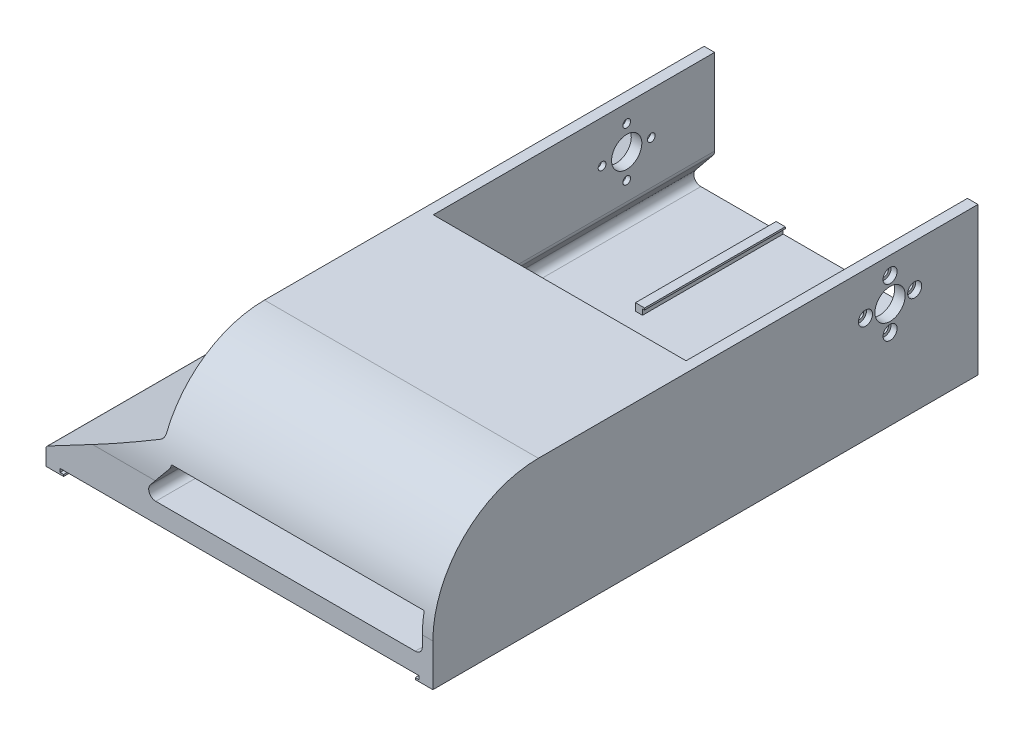
from build123d import *

# Parameters (mm, degrees)
BOSS_EXTRUDE1_DEPTH = 155
SKETCH3_R           = 4.3
SKETCH3_R_2         = 1.2
CUT_EXTRUDE1_DEPTH  = 3
SKETCH2_R           = 4.3
SKETCH2_R_2         = 1.1
CUT_EXTRUDE2_DEPTH  = 178.191866295
SKETCH4_R           = 2
CUT_EXTRUDE3_DEPTH  = 1.7
CUT_EXTRUDE4_START  = -1.7
SKETCH5_R           = 2
CUT_EXTRUDE4_DEPTH  = 1.7
CUT_EXTRUDE5_START  = -1.7
SKETCH5_4_R         = 2
CUT_EXTRUDE5_DEPTH  = 181.180461853
FILLET1_R           = 2
FILLET2_R           = 1
BOSS_EXTRUDE3_DEPTH = 71.886297018
FILLET3_R           = 30
BOSS_EXTRUDE4_DEPTH = 40


with BuildPart() as part:
    # Sketch1 → Boss-Extrude1 (new body)
    with BuildSketch(Plane.XY):
        Polygon((29.816959294, 42), (29.816959294, 17), (21.703256312, 7), (101.703256312, 7), (101.703256312, 42), (104.703256312, 42), (104.703256312, 14.387755102), (104.703256312, 0), (99.703256312, 0), (99.703256312, 0.5), (100.703256312, 0.5), (100.703256312, 1.5), (-1.296743688, 1.5), (-1.296743688, 0.5), (-0.296743688, 0.5), (-0.296743688, 0), (-5.296743688, 0), (-5.296743688, 5), (26.816959294, 22), (26.816959294, 42), align=None)
    extrude(amount=BOSS_EXTRUDE1_DEPTH)

    # Sketch3 → Cut-Extrude1 (cut)
    with BuildSketch(Plane.ZY.offset(-101.703256312)):
        with Locations((25, 30)):
            Circle(SKETCH3_R)
        with Locations((25, 37)):
            Circle(SKETCH3_R_2)
        with Locations((32, 30)):
            Circle(SKETCH3_R_2)
        with Locations((25, 23)):
            Circle(SKETCH3_R_2)
        with Locations((18, 30)):
            Circle(SKETCH3_R_2)
    extrude(amount=-CUT_EXTRUDE1_DEPTH, mode=Mode.SUBTRACT)

    # Sketch2 → Cut-Extrude2 (cut, through all)
    with BuildSketch(Plane(origin=(29.816959294, 0, 0), x_dir=(0, 0, -1), z_dir=(1, 0, 0))):
        with Locations(Location((-25, 30, 0), (0, 0, 180))):
            Circle(SKETCH2_R)
        with Locations(Location((-25, 37, 0), (0, 0, 90))):
            Circle(SKETCH2_R_2)
        with Locations(Location((-18, 30, 0), (0, 0, 90))):
            Circle(SKETCH2_R_2)
        with Locations(Location((-25, 23, 0), (0, 0, 90))):
            Circle(SKETCH2_R_2)
        with Locations(Location((-32, 30, 0), (0, 0, 90))):
            Circle(SKETCH2_R_2)
    extrude(amount=-CUT_EXTRUDE2_DEPTH, mode=Mode.SUBTRACT)

    # Sketch4 → Cut-Extrude3 (cut)
    with BuildSketch(Plane(origin=(104.703256312, 0, 0), x_dir=(0, 0, -1), z_dir=(1, 0, 0))):
        with Locations(Location((-32, 30, 0), (0, 0, 90))):
            Circle(SKETCH4_R)
        with Locations(Location((-25, 37, 0), (0, 0, 90))):
            Circle(SKETCH4_R)
        with Locations(Location((-18, 30, 0), (0, 0, 90))):
            Circle(SKETCH4_R)
        with Locations(Location((-25, 23, 0), (0, 0, 90))):
            Circle(SKETCH4_R)
    extrude(amount=-CUT_EXTRUDE3_DEPTH, mode=Mode.SUBTRACT)

    # Sketch5 → Cut-Extrude4 (cut)
    with BuildSketch(Plane.ZY.offset(-26.816959294).offset(CUT_EXTRUDE4_START)):
        with Locations(Location((25, 23, 0), (0, 0, 90))):
            Circle(SKETCH5_R)
        with Locations(Location((32, 30, 0), (0, 0, 90))):
            Circle(SKETCH5_R)
        with Locations(Location((25, 37, 0), (0, 0, 90))):
            Circle(SKETCH5_R)
        with Locations(Location((18, 30, 0), (0, 0, 90))):
            Circle(SKETCH5_R)
    extrude(amount=CUT_EXTRUDE4_DEPTH, mode=Mode.SUBTRACT)

    # Sketch5<4> → Cut-Extrude5 (cut, through all)
    with BuildSketch(Plane.ZY.offset(-26.816959294).offset(CUT_EXTRUDE5_START)):
        with Locations(Location((25, 23, 0), (0, 0, 90))):
            Circle(SKETCH5_4_R)
        with Locations(Location((32, 30, 0), (0, 0, 90))):
            Circle(SKETCH5_4_R)
        with Locations(Location((25, 37, 0), (0, 0, 90))):
            Circle(SKETCH5_4_R)
        with Locations(Location((18, 30, 0), (0, 0, 90))):
            Circle(SKETCH5_4_R)
    extrude(amount=CUT_EXTRUDE5_DEPTH, mode=Mode.SUBTRACT)

    # Fillet1
    fillet1_edges = [part.edges().sort_by_distance(p)[0] for p in [
        (101.703256312, 7, 77.5),
        (29.816959294, 17, 77.5),
        (21.703256312, 7, 77.5),
        (26.816959294, 22, 11.633974596),
        (26.816959294, 22, 90.866025404),
    ]]
    fillet(fillet1_edges, radius=FILLET1_R)

    # Fillet2
    fillet2_edges = [part.edges().sort_by_distance(p)[0] for p in [
        (-5.296743688, 5, 77.5),
    ]]
    fillet(fillet2_edges, radius=FILLET2_R)

    # Sketch8 → Boss-Extrude3 (add)
    with BuildSketch(Plane(origin=(29.816959294, 0, 0), x_dir=(0, 0, -1), z_dir=(1, 0, 0))):
        with BuildLine():
            Line((-155, 42), (-155, 17.709314663))
            Line((-155, 17.709314663), (-145, 17.709314663))
            ThreePointArc((-145, 17.709314663), (-114.980171869, 36.135513896), (-80, 32))
            Line((-80, 32), (-80, 42))
            Line((-80, 42), (-155, 42))
        make_face()
    extrude(amount=BOSS_EXTRUDE3_DEPTH)

    # Fillet3
    # the kernel refuses this fillet: 30 mm, written as the material it takes off along each edge
    with BuildSketch(Plane(origin=(-48.183040706, 42, 155), x_dir=(0, -1, 0), z_dir=(1, 0, 0))) as fillet3_piece_1:
        with BuildLine():
            CenterArc((FILLET3_R, FILLET3_R), FILLET3_R, 180, 90)
            Line((0, FILLET3_R), (0, 0))
            Line((0, 0), (FILLET3_R, 0))
        make_face()
    extrude(amount=227.886297018, mode=Mode.SUBTRACT)

    # Sketch10 → Boss-Extrude4 (add)
    with BuildSketch(Plane(origin=(0, 0, 0), x_dir=(-1, 0, 0), z_dir=(0, 0, -1))):
        Polygon((-74.703256312, 7), (-74.703256312, 8.6), (-74.103256312, 8.6), (-74.103256312, 9.1), (-76.703256312, 9.1), (-76.703256312, 7), align=None)
        Polygon((-47.303256312, 7), (-47.303256312, 9.1), (-49.903256312, 9.1), (-49.903256312, 8.6), (-49.303256312, 8.6), (-49.303256312, 7), align=None)
    extrude(amount=-BOSS_EXTRUDE4_DEPTH)


solid = part.part
